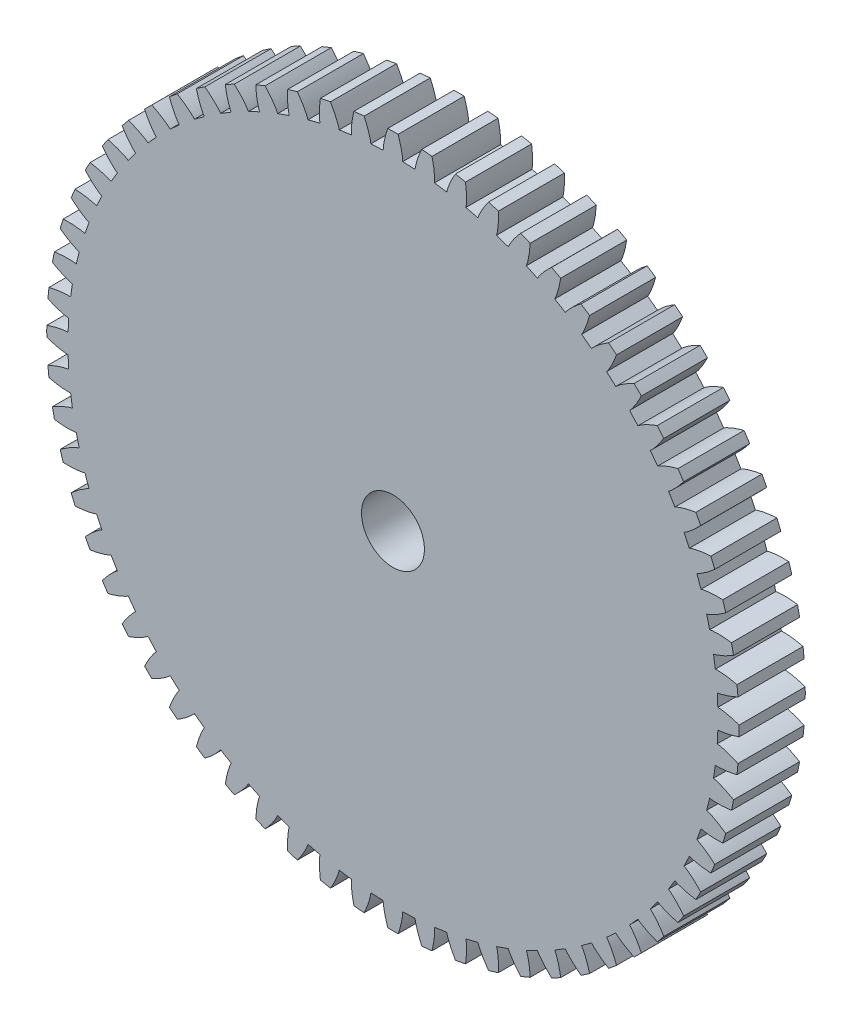
from build123d import *

# Parameters (mm, degrees)
SKETCH1_R               = 52.3875
BOSS_EXTRUDE1_DEPTH     = 10
CUT_EXTRUDE2_DEPTH      = 11
CIRPATTERN1_COUNT       = 64
CUT_EXTRUDE4_DEPTH      = 12
CUT_EXTRUDE4_DEPTH_BACK = 12
SKETCH3_R               = 4.7625


with BuildPart() as part:
    # Sketch1 → Boss-Extrude1 (new body)
    with BuildSketch(Plane.XY):
        Circle(SKETCH1_R)
    extrude(amount=BOSS_EXTRUDE1_DEPTH)

    # Sketch2 → Cut-Extrude2 (cut, symmetric)
    with BuildSketch(Plane.XY):
        with BuildLine():
            add(Edge.make_bspline(
                [(49.159639133, 1.479588071), (49.164532349, 1.479697342), (49.178261104, 1.479886221), (49.204235196, 1.479778867), (49.246654771, 1.478943821), (49.300763008, 1.476909208), (49.370777189, 1.473163832), (49.453364186, 1.467315202), (49.544251653, 1.45938075), (49.643281434, 1.449119138), (49.742216894, 1.437438853), (49.841046626, 1.424441558), (49.939623832, 1.41027914), (50.059190432, 1.391684559), (50.202785797, 1.367385769), (50.370974222, 1.336057228), (50.562150691, 1.297065366), (50.757484667, 1.253608942), (50.950107555, 1.207789278), (51.145239697, 1.157959763), (51.334405913, 1.107242401), (51.53146561, 1.050918271), (51.71364732, 0.997077963), (51.918436872, 0.93270049), (52.083896995, 0.879565753), (52.255414681, 0.821277521), (52.33898356, 0.792405599), (52.381731035, 0.777438111)],
                knots=[0, 0, 0, 0, 0, 0.005376749, 0.015083688, 0.02853182, 0.04661014, 0.06485485, 0.092110526, 0.119476176, 0.146842496, 0.174208854, 0.201574956, 0.228941013, 0.256307345, 0.307035032, 0.361767352, 0.416499661, 0.471231937, 0.525964282, 0.580696616, 0.635428982, 0.690161387, 0.744893688, 0.799626082, 0.854358407, 0.909090914, 0.909090914, 0.909090914, 0.909090914, 0.909090914], degree=4))
            Line((52.381731035, 0.777438111), (59.993392739, 0.890408717))
            add(Edge.make_bspline(
                [(59.993392739, 0.890408717), (59.992787708, 0.931174102), (59.991502941, 1.010570522), (59.988055764, 1.210584827), (59.984507625, 1.36359621), (59.979310115, 1.584822535), (59.974081063, 1.765001958), (59.96785059, 1.969926675), (59.961196969, 2.159896403), (59.953784069, 2.358788491), (59.945792547, 2.552406181), (59.937151262, 2.748893749), (59.927840416, 2.944066013), (59.917976201, 3.139211092), (59.907316726, 3.335599513), (59.896291914, 3.529068186), (59.884174285, 3.727729146), (59.872175577, 3.917436287), (59.858289914, 4.121984928), (59.845833116, 4.301809275), (59.829321627, 4.52247978), (59.817854942, 4.67510215), (59.80168069, 4.874491213), (59.79517706, 4.953631247), (59.791783471, 4.994259639)],
                knots=[0.083333333, 0.083333333, 0.083333333, 0.083333333, 0.083333333, 0.123015873, 0.162698413, 0.202380952, 0.242063492, 0.281746032, 0.321428571, 0.361111111, 0.400793651, 0.44047619, 0.48015873, 0.51984127, 0.55952381, 0.599206349, 0.638888889, 0.678571429, 0.718253968, 0.757936508, 0.797619048, 0.837301587, 0.876984127, 0.916666667, 0.916666667, 0.916666667, 0.916666667, 0.916666667], degree=4))
            Line((59.791783471, 4.994259639), (52.205700943, 4.360612948))
            add(Edge.make_bspline(
                [(49.067947025, 3.346023798), (49.07282739, 3.346394672), (49.08650855, 3.347552356), (49.112347047, 3.350205099), (49.154480512, 3.355193969), (49.208128776, 3.36252232), (49.277438709, 3.37311225), (49.359054761, 3.387027659), (49.448726867, 3.403832434), (49.546273979, 3.423751249), (49.64358817, 3.445072661), (49.740668052, 3.467694379), (49.837382422, 3.491450857), (49.954550689, 3.521675475), (50.095072905, 3.559932068), (50.259380723, 3.607595101), (50.445814753, 3.665137778), (50.635948668, 3.727531025), (50.823152912, 3.7920104), (51.012461293, 3.860726266), (51.195745451, 3.929740942), (51.386335522, 4.005109084), (51.562362704, 4.076547066), (51.759856042, 4.16068743), (51.919311315, 4.229784237), (52.08428985, 4.304603468), (52.164626379, 4.341527547), (52.205700943, 4.360612948)],
                knots=[0, 0, 0, 0, 0, 0.005376749, 0.015083688, 0.02853182, 0.04661014, 0.06485485, 0.092110526, 0.119476176, 0.146842496, 0.174208854, 0.201574956, 0.228941013, 0.256307345, 0.307035032, 0.361767352, 0.416499661, 0.471231937, 0.525964282, 0.580696616, 0.635428982, 0.690161387, 0.744893688, 0.799626082, 0.854358407, 0.909090914, 0.909090914, 0.909090914, 0.909090914, 0.909090914], degree=4))
            Line((49.067947025, 3.346023798), (49.159639133, 1.479588071))
        make_face()
    cut_extrude2 = extrude(amount=CUT_EXTRUDE2_DEPTH, both=True, mode=Mode.SUBTRACT)

    # CirPattern1: Cut-Extrude2 ×64 about axis
    cirpattern1_axis = Axis((0, 0, -0.5), (0, 0, 1))
    for i in range(1, CIRPATTERN1_COUNT):
        add(cut_extrude2.rotate(cirpattern1_axis, i * 360 / CIRPATTERN1_COUNT), mode=Mode.SUBTRACT)

    # Sketch3 → Cut-Extrude4 (cut, two sides: drawn at the far end of the back side and taken through both)
    with BuildSketch(Plane.XY.offset(-CUT_EXTRUDE4_DEPTH_BACK)):
        Circle(SKETCH3_R)
    extrude(amount=CUT_EXTRUDE4_DEPTH + CUT_EXTRUDE4_DEPTH_BACK, mode=Mode.SUBTRACT)


solid = part.part
